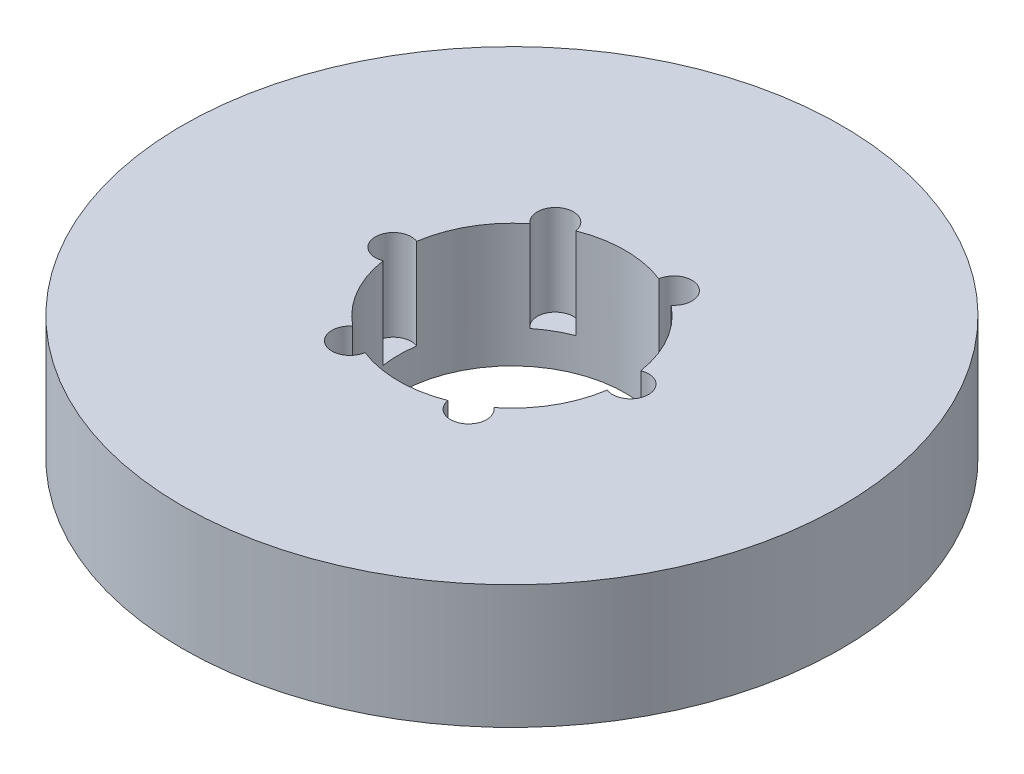
from build123d import *

# Parameters (mm, degrees)
SKETCH1_R           = 80
BOSS_EXTRUDE1_DEPTH = 30
SKETCH2_R           = 27.5
CUT_EXTRUDE1_DEPTH  = 118.046999107
SKETCH3_R           = 4.376703516
CUT_EXTRUDE2_DEPTH  = 22.005028175
CIRPATTERN1_COUNT   = 6


with BuildPart() as part:
    # Sketch1 → Boss-Extrude1 (new body)
    with BuildSketch(Plane(origin=(0, 0, 0), x_dir=(1, 0, 0), z_dir=(0, 1, 0))):
        Circle(SKETCH1_R)
    extrude(amount=BOSS_EXTRUDE1_DEPTH)

    # Sketch2 → Cut-Extrude1 (cut, through all)
    with BuildSketch(Plane(origin=(0, 0, 0), x_dir=(1, 0, 0), z_dir=(0, 1, 0))):
        Circle(SKETCH2_R)
    extrude(amount=CUT_EXTRUDE1_DEPTH, mode=Mode.SUBTRACT)

    # Sketch3 → Cut-Extrude2 (cut)
    with BuildSketch(Plane(origin=(0, 30, 0), x_dir=(1, 0, 0), z_dir=(0, 1, 0))):
        with Locations((-28.783415245, 0)):
            Circle(SKETCH3_R)
    cut_extrude2 = extrude(amount=-CUT_EXTRUDE2_DEPTH, mode=Mode.SUBTRACT)

    # CirPattern1: Cut-Extrude2 ×6 about axis
    cirpattern1_axis = Axis((0, 0, 0), (0, 1, 0))
    for i in range(1, CIRPATTERN1_COUNT):
        add(cut_extrude2.rotate(cirpattern1_axis, i * 360 / CIRPATTERN1_COUNT), mode=Mode.SUBTRACT)


solid = part.part
